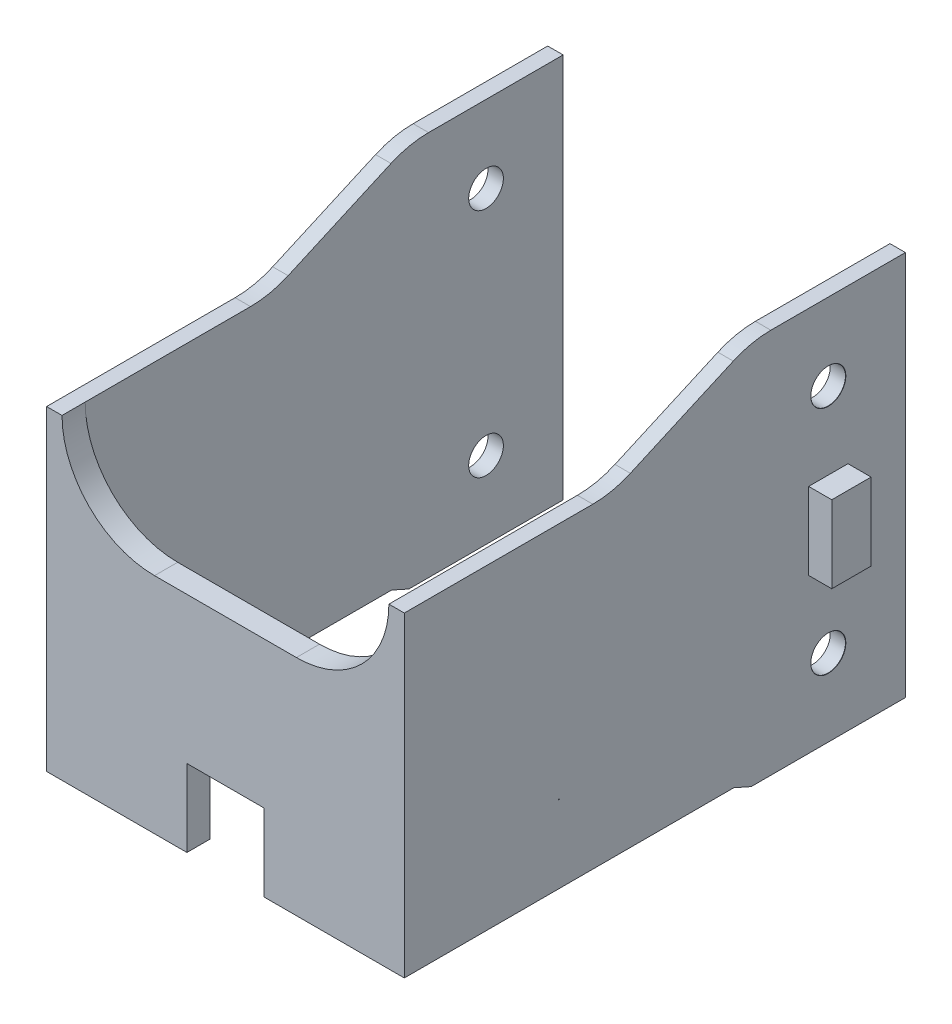
from build123d import *

# Parameters (mm, degrees)
SKETCH_1_W                   = 2
SKETCH_1_H                   = 10
EXTRUDE_1_DEPTH              = 62
EXTRUDE_1_2_DEPTH            = 62
SKETCH_2_W                   = 46.4
SKETCH_2_H                   = 10
EXTRUDE_2_DEPTH              = 3
SKETCH_3_W                   = 2
SKETCH_3_H                   = 20
EXTRUDE_3_DEPTH              = 20
EXTRUDE_4_DEPTH              = 2
MIRROR_3_COPY_1_SKETCH_W     = 2
MIRROR_3_COPY_1_SKETCH_H     = 20
MIRROR_3_COPY_1_DEPTH        = 20
MIRROR_3_COPY_2_DEPTH        = 2
MIRROR_3_COPY_3_SKETCH_W     = 2
MIRROR_3_COPY_3_SKETCH_H     = 20
MIRROR_3_COPY_3_DEPTH        = 20
EXTRUDE_5_DEPTH              = 9
HOLE_WIZARD_M4_1_D           = 4.5
HOLE_WIZARD_M4_1_CSINK_D     = 4.55
HOLE_WIZARD_M4_1_CSINK_ANGLE = 90
SKETCH_10_W                  = 5.1
SKETCH_10_H                  = 10
EXTRUDE_6_DEPTH              = 3
EXTRUDE_7_DEPTH              = 10
EXTRUDE_8_REACH              = 76.407
SKETCH_12_W                  = 2
SKETCH_12_H                  = 22
SKETCH_13_W                  = 10
SKETCH_13_H                  = 10
CUT_EXTRUDE_1_DEPTH          = 10
FILLET_1_R                   = 12
FILLET_2_R                   = 12


with BuildPart() as part:
    # 스케치1 → 보스-돌출1 (new body)
    with BuildSketch(Plane.XY):
        with Locations((-22.2, 0)):
            Rectangle(SKETCH_1_W, SKETCH_1_H)
    extrude(amount=EXTRUDE_1_DEPTH)



with BuildPart() as body_2:
    # 스케치1 → Extrude 1 2 (new body)
    with BuildSketch(Plane.XY):
        with Locations((22.2, 0)):
            Rectangle(SKETCH_1_W, SKETCH_1_H)
    extrude(amount=EXTRUDE_1_2_DEPTH)


with BuildPart() as part_1:
    add(part.part)

    add(body_2.part)  # 보스-돌출2 merges body 2
    # 스케치2 → 보스-돌출2 (add)
    with BuildSketch(Plane.XY.offset(62)):
        Rectangle(SKETCH_2_W, SKETCH_2_H)
    extrude(amount=EXTRUDE_2_DEPTH)

    # 스케치3 → 보스-돌출3 (add)
    with BuildSketch(Plane(origin=(0, 5, 0), x_dir=(1, 0, 0), z_dir=(0, 1, 0))):
        with Locations((-22.2, -10)):
            Rectangle(SKETCH_3_W, SKETCH_3_H)
        with Locations((22.2, -10)):
            Rectangle(SKETCH_3_W, SKETCH_3_H)
    extrude_3 = extrude(amount=EXTRUDE_3_DEPTH)

    # 스케치4 → 보스-돌출4 (add)
    with BuildSketch(Plane.ZY.offset(-21.2)):
        Polygon((20, 25), (20, 5), (65, 5), align=None)
    extrude_4 = extrude(amount=-EXTRUDE_4_DEPTH)

    # 대칭 복사1: 보스-돌출3, 보스-돌출4 across plane
    add(extrude_3.mirror(Plane.ZX))
    add(extrude_4.mirror(Plane.ZX))

    # 대칭 복사3: 보스-돌출4 across plane
    add(extrude_4.mirror(Plane.ZY))

    # 대칭 복사3 copy 1 sketch → 대칭 복사3 copy 1 (add)
    with BuildSketch(Plane(origin=(0, -5, 0), x_dir=(-1, 0, 0), z_dir=(0, -1, 0))):
        with Locations((-22.2, -10)):
            Rectangle(MIRROR_3_COPY_1_SKETCH_W, MIRROR_3_COPY_1_SKETCH_H)
        with Locations((22.2, -10)):
            Rectangle(MIRROR_3_COPY_1_SKETCH_W, MIRROR_3_COPY_1_SKETCH_H)
    extrude(amount=MIRROR_3_COPY_1_DEPTH)

    # 대칭 복사3 copy 2 sketch → 대칭 복사3 copy 2 (add)
    with BuildSketch(Plane(origin=(-21.2, 0, 0), x_dir=(0, 0, 1), z_dir=(1, 0, 0))):
        Polygon((20, 25), (20, 5), (65, 5), align=None)
    extrude(amount=-MIRROR_3_COPY_2_DEPTH)

    # 대칭 복사3 copy 3 sketch → 대칭 복사3 copy 3 (add)
    with BuildSketch(Plane(origin=(0, 5, 0), x_dir=(-1, 0, 0), z_dir=(0, 1, 0))):
        with Locations((-22.2, 10)):
            Rectangle(MIRROR_3_COPY_3_SKETCH_W, MIRROR_3_COPY_3_SKETCH_H)
        with Locations((22.2, 10)):
            Rectangle(MIRROR_3_COPY_3_SKETCH_W, MIRROR_3_COPY_3_SKETCH_H)
    extrude(amount=MIRROR_3_COPY_3_DEPTH)

    # 스케치6 → 보스-돌출5 (add)
    with BuildSketch(Plane.XZ.offset(5)):
        Polygon((-23.2, 65), (-23.2, 44.637351208), (-21.2, 44.637351208), (-21.2, 62), (21.2, 62), (21.2, 45), (23.2, 45), (23.2, 65), align=None)
    extrude(amount=EXTRUDE_5_DEPTH)

    # M4 여유 구멍1 (through all)
    with Locations(Plane(origin=(23.2, 0, 0), x_dir=(0, 0, -1), z_dir=(1, 0, 0))):
        with Locations((-10, -15), (-10, 15)):
            CounterSinkHole(HOLE_WIZARD_M4_1_D / 2, HOLE_WIZARD_M4_1_CSINK_D / 2, counter_sink_angle=HOLE_WIZARD_M4_1_CSINK_ANGLE)

    # 스케치10 → 보스-돌출6 (add)
    with BuildSketch(Plane(origin=(23.2, 0, 0), x_dir=(0, 0, -1), z_dir=(1, 0, 0))):
        with Locations((-10, 0)):
            Rectangle(SKETCH_10_W, SKETCH_10_H)
    extrude_6 = extrude(amount=EXTRUDE_6_DEPTH)

    # 대칭 복사4: 보스-돌출6 across plane
    add(extrude_6.mirror(Plane.ZY))

    # 스케치11 → 보스-돌출7 (add)
    with BuildSketch(Plane.XZ.offset(14)):
        Polygon((-23.2, 15), (-21.2, 15), (-21.2, 62), (21.2, 62), (21.2, 15), (23.2, 15), (23.2, 65), (-23.2, 65), align=None)
    extrude(amount=EXTRUDE_7_DEPTH)

    # 스케치12 → 보스-돌출8 (add, up to next)
    with BuildSketch(Plane.XY.offset(65), mode=Mode.PRIVATE) as extrude_8_sk1:
        with Locations((-22.2, 6)):
            Rectangle(SKETCH_12_W, SKETCH_12_H)
    extrude_8_tool1 = extrude(extrude_8_sk1.sketch, amount=-EXTRUDE_8_REACH, mode=Mode.PRIVATE) - part_1.part
    # 스케치12 → 보스-돌출8 (add, up to next)
    with BuildSketch(Plane.XY.offset(65), mode=Mode.PRIVATE) as extrude_8_sk2:
        with Locations((22.2, 6)):
            Rectangle(SKETCH_12_W, SKETCH_12_H)
    extrude_8_tool2 = extrude(extrude_8_sk2.sketch, amount=-EXTRUDE_8_REACH, mode=Mode.PRIVATE) - part_1.part
    add(extrude_8_tool1.solids().sort_by_distance((-22.2, 6, 65))[0])
    add(extrude_8_tool2.solids().sort_by_distance((22.2, 6, 65))[0])

    # 스케치13 → 컷-돌출1 (cut)
    with BuildSketch(Plane.XY.offset(65)):
        with Locations((0, -19)):
            Rectangle(SKETCH_13_W, SKETCH_13_H)
    extrude(amount=-CUT_EXTRUDE_1_DEPTH, mode=Mode.SUBTRACT)

    # 필렛1
    fillet_1_edges = [part_1.edges().sort_by_distance(p)[0] for p in [
        (21.2, 5, 63.5),
        (-21.2, 5, 63.5),
    ]]
    fillet(fillet_1_edges, radius=FILLET_1_R - 0.0001)  # a hair under: the kernel refuses the full size

    # 필렛2
    fillet_2_edges = [part_1.edges().sort_by_distance(p)[0] for p in [
        (-22.2, 17, 38),
        (22.2, 17, 38),
        (-22.2, 25, 20),
        (22.2, 25, 20),
    ]]
    fillet(fillet_2_edges, radius=FILLET_2_R)


solid = part_1.part
